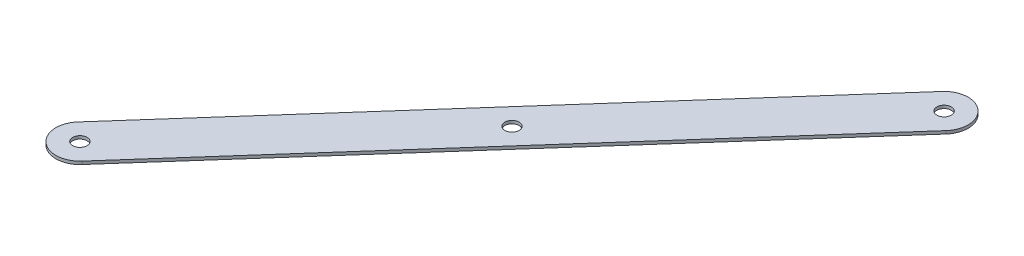
from build123d import *

# Parameters (mm, degrees)
SKETCH1_R           = 3.81
BOSS_EXTRUDE1_DEPTH = 1.5875


with BuildPart() as part:
    # Sketch1 → Boss-Extrude1 (new body)
    with BuildSketch(Plane(origin=(0, 0, 0), x_dir=(1, 0, 0), z_dir=(0, 1, 0))):
        with BuildLine():
            Line((-9.511548238, 8.415488704), (205.083413705, 250.959968766))
            ThreePointArc((205.083413705, 250.959968766), (223.010450646, 252.0560283), (224.10651018, 234.128991359))
            Line((224.10651018, 234.128991359), (9.511548238, -8.415488704))
            ThreePointArc((9.511548238, -8.415488704), (-8.415488704, -9.511548238), (-9.511548238, 8.415488704))
        make_face()
        with Locations((107.297480971, 121.272240031)):
            Circle(SKETCH1_R, mode=Mode.SUBTRACT)
        with Locations((214.594961942, 242.544480063)):
            Circle(SKETCH1_R, mode=Mode.SUBTRACT)
        Circle(SKETCH1_R, mode=Mode.SUBTRACT)
    extrude(amount=BOSS_EXTRUDE1_DEPTH)


solid = part.part
